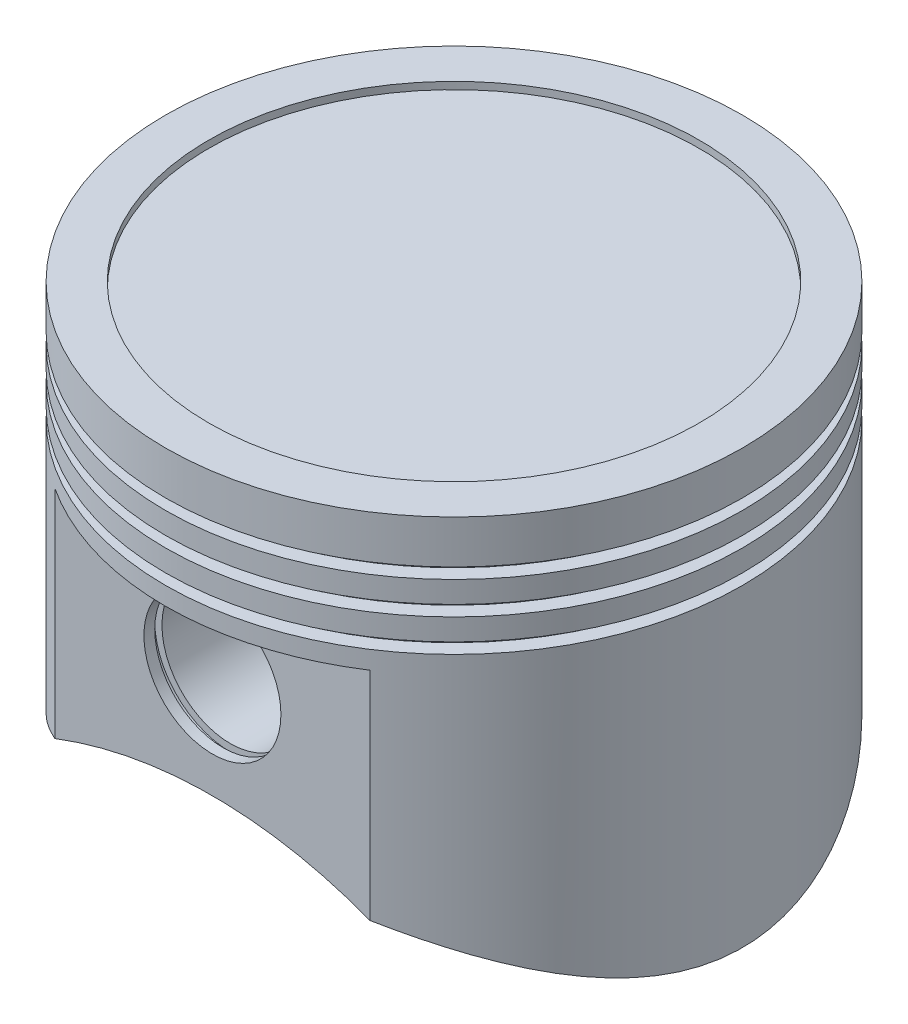
from build123d import *

# Parameters (mm, degrees)
CROQUIS7_R                 = 40
SALIENTE_EXTRUIR3_DEPTH    = 60
CORTAR_EXTRUIR2_DEPTH      = 83.462112512
CORTAR_EXTRUIR2_DEPTH_BACK = 83.462112512
CROQUIS8_W                 = 6.5
CROQUIS8_H                 = 41
CROQUIS9_W                 = 4
CROQUIS9_H                 = 1.5
CORTAR_EXTRUIR3_DEPTH      = 43
CROQUIS11_R                = 34
CORTAR_EXTRUIR4_DEPTH      = 1
CROQUIS12_R                = 9.5
CORTAR_EXTRUIR5_DEPTH      = 110
CORTAR_EXTRUIR6_DEPTH      = 83.462112512
CORTAR_EXTRUIR6_DEPTH_BACK = 83.462112512
CROQUIS13_R                = 60.833333333
CROQUIS14_R                = 9.5
SALIENTE_EXTRUIR4_DEPTH    = 15
REDONDEO1_R                = 1
CROQUIS15_R                = 10.5
CROQUIS15_R_2              = 9.5
CORTAR_EXTRUIR7_DEPTH      = 0.5


# Read off the part's stored shape, not the designer's step: Simetría6
with BuildPart() as part:
    # Croquis7 → Saliente-Extruir3 (new body)
    with BuildSketch(Plane(origin=(0, 0, 0), x_dir=(1, 0, 0), z_dir=(0, 1, 0))):
        with Locations(Location((0, 0, 0), (0, 0, 270))):
            Circle(CROQUIS7_R)
    extrude(amount=-SALIENTE_EXTRUIR3_DEPTH)

    # Croquis8 → Cortar-Extruir2 (cut, two sides: drawn at the far end of the back side and taken through both)
    with BuildSketch(Plane(origin=(0, 0, 0), x_dir=(0, 0, -1), z_dir=(1, 0, 0)).offset(-CORTAR_EXTRUIR2_DEPTH_BACK)):
        with Locations((36.75, -39.5)):
            Rectangle(CROQUIS8_W, CROQUIS8_H)
        with Locations((-36.75, -39.5)):
            Rectangle(CROQUIS8_W, CROQUIS8_H)
    extrude(amount=CORTAR_EXTRUIR2_DEPTH + CORTAR_EXTRUIR2_DEPTH_BACK, mode=Mode.SUBTRACT)

    # Cortar-Barrer2: sweep along a curve in space
    with BuildLine() as cortar_barrer2_path:
        ThreePointArc((0, 0, 40), (28.284271247, 0, 28.284271247), (40, 0, 0))
        ThreePointArc((40, 0, 0), (28.284271247, 0, -28.284271247), (0, 0, -40))
        ThreePointArc((0, 0, -40), (-28.284271247, 0, -28.284271247), (-40, 0, 0))
        ThreePointArc((-40, 0, 0), (-28.284271247, 0, 28.284271247), (0, 0, 40))
    # Croquis9 → Cortar-Barrer2 (sweep, cut)
    with BuildSketch(Plane(origin=(0, 0, 0), x_dir=(0, 0, -1), z_dir=(1, 0, 0))):
        with Locations((-40, -6.75)):
            Rectangle(CROQUIS9_W, CROQUIS9_H)
        with Locations((-40, -11.25)):
            Rectangle(CROQUIS9_W, CROQUIS9_H)
        with Locations((-40, -15.75)):
            Rectangle(CROQUIS9_W, CROQUIS9_H)
    sweep(path=cortar_barrer2_path.line, mode=Mode.SUBTRACT)

    # Croquis10 → Cortar-Extruir3 (cut)
    with BuildSketch(Plane.XZ.offset(60)):
        with BuildLine():
            Line((-20.316249654, -28.5), (20.316249654, -28.5))
            ThreePointArc((20.316249654, -28.5), (35, 0), (20.316249654, 28.5))
            Line((20.316249654, 28.5), (-20.316249654, 28.5))
            ThreePointArc((-20.316249654, 28.5), (-35, 0), (-20.316249654, -28.5))
        make_face()
    extrude(amount=-CORTAR_EXTRUIR3_DEPTH, mode=Mode.SUBTRACT)

    # Croquis11 → Cortar-Extruir4 (cut)
    with BuildSketch(Plane(origin=(0, 0, 0), x_dir=(1, 0, 0), z_dir=(0, 1, 0))):
        with Locations(Location((0, 0, 0), (0, 0, 270))):
            Circle(CROQUIS11_R)
    extrude(amount=-CORTAR_EXTRUIR4_DEPTH, mode=Mode.SUBTRACT)

    # Croquis12 → Cortar-Extruir5 (cut)
    with BuildSketch(Plane.XY.offset(33.5)):
        with Locations((0, -30.5)):
            Circle(CROQUIS12_R)
    extrude(amount=-CORTAR_EXTRUIR5_DEPTH, mode=Mode.SUBTRACT)

    # Croquis13 → Cortar-Extruir6 (cut, two sides: drawn at the far end of the back side and taken through both)
    with BuildSketch(Plane.XY.offset(-CORTAR_EXTRUIR6_DEPTH_BACK)):
        with Locations((0, -105.833333333)):
            Circle(CROQUIS13_R)
    extrude(amount=CORTAR_EXTRUIR6_DEPTH + CORTAR_EXTRUIR6_DEPTH_BACK, mode=Mode.SUBTRACT)

    # Croquis14 → Saliente-Extruir4 (add)
    with BuildSketch(Plane(origin=(0, 0, 28.5), x_dir=(-1, 0, 0), z_dir=(0, 0, -1))):
        with BuildLine():
            Line((-12.5, -30.5), (-12.5, -17))
            Line((-12.5, -17), (12.5, -17))
            Line((12.5, -17), (12.5, -30.5))
            ThreePointArc((12.5, -30.5), (0, -43), (-12.5, -30.5))
        make_face()
        with Locations(Location((0, -30.5, 0), (0, 0, 180))):
            Circle(CROQUIS14_R, mode=Mode.SUBTRACT)
    saliente_extruir4 = extrude(amount=SALIENTE_EXTRUIR4_DEPTH)

    # Redondeo1
    redondeo1_edges = [part.edges().sort_by_distance(p)[0] for p in [
        (0, -43, 28.5),
        (-12.5, -23.75, 28.5),
        (12.5, -23.75, 28.5),
    ]]
    fillet(redondeo1_edges, radius=REDONDEO1_R)

    # Simetría4: Saliente-Extruir4 across plane
    add(saliente_extruir4.mirror(Plane.XY))

    # Simetría6
    split(bisect_by=Plane.XY, keep=Keep.TOP)

    # Simetr_a6 2: part across plane


with BuildPart() as part_1:
    add(part.part)
    add(part.part.mirror(Plane.XY))

    # Croquis15 → Cortar-Extruir7 (cut, symmetric)
    with BuildSketch(Plane(origin=(0, 0, -31.5), x_dir=(-1, 0, 0), z_dir=(0, 0, -1))):
        with Locations((0, -30.5)):
            Circle(CROQUIS15_R)
        with Locations((0, -30.5)):
            Circle(CROQUIS15_R_2, mode=Mode.SUBTRACT)
    cortar_extruir7 = extrude(amount=CORTAR_EXTRUIR7_DEPTH, both=True, mode=Mode.SUBTRACT)

    # Simetría7: Cortar-Extruir7 across plane
    add(cortar_extruir7.mirror(Plane.XY), mode=Mode.SUBTRACT)


solid = part_1.part
